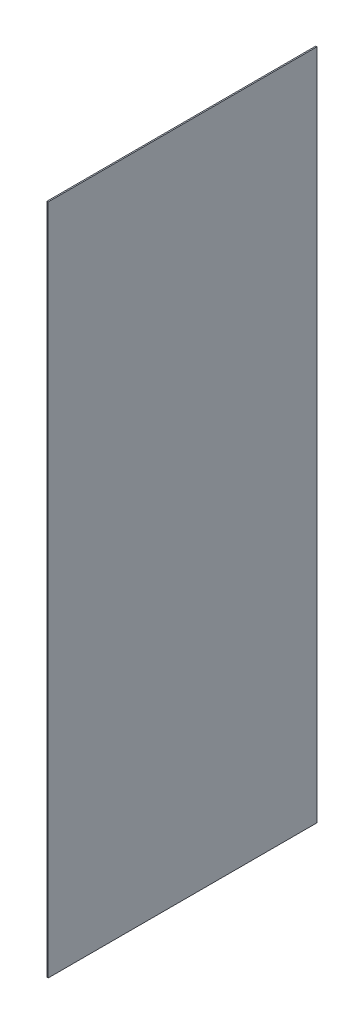
from build123d import *

# Parameters (mm, degrees)
SKETCH1_W          = 260
SKETCH1_H          = 650
BASE_FLANGE1_DEPTH = 1.2


# Sheet-metal steps are written as plain solids
with BuildPart() as part:
    # Sketch1 → Base-Flange1 (new body)
    with BuildSketch(Plane(origin=(0, 0, 0), x_dir=(0, 0, -1), z_dir=(1, 0, 0))):
        Rectangle(SKETCH1_W, SKETCH1_H)
    extrude(amount=-BASE_FLANGE1_DEPTH)


solid = part.part
